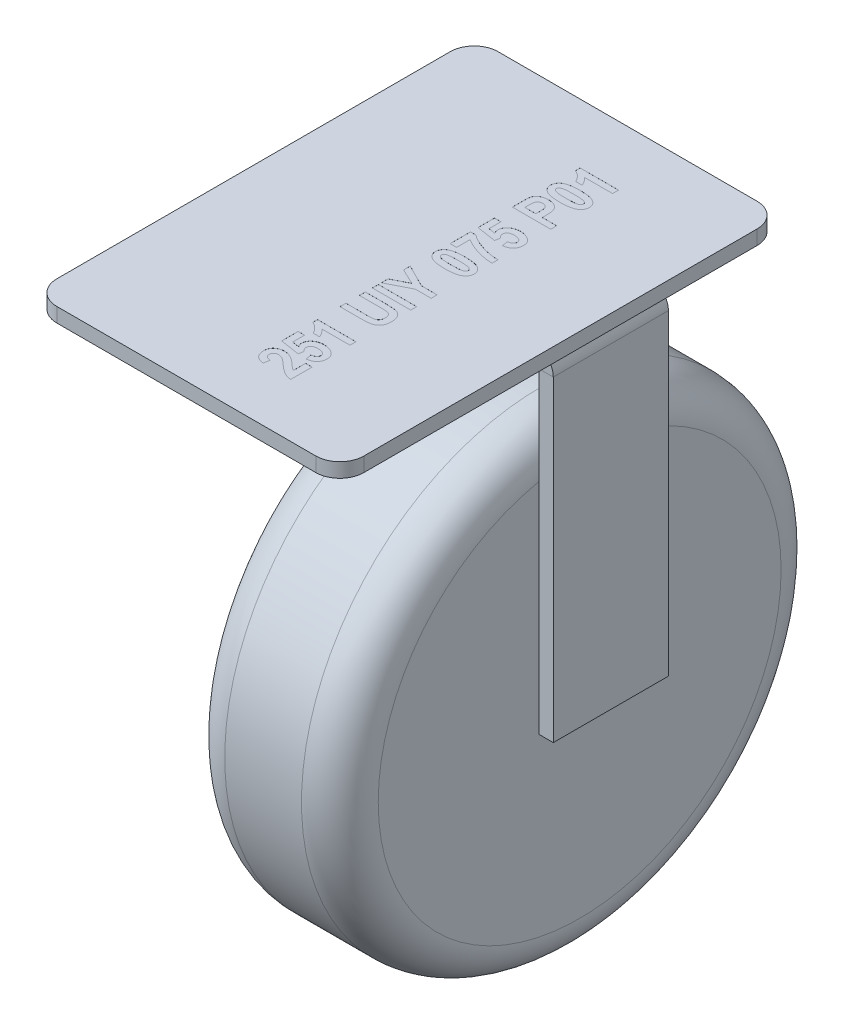
from build123d import *

# Parameters (mm, degrees)
SKETCH1_R                      = 50
BOSS_EXTRUDE1_DEPTH            = 16
FILLET1_R                      = 8
SKETCH2_W                      = 64
SKETCH2_H                      = 92
BASE_FLANGE1_DEPTH             = 3
SKETCH4_W                      = 45
SKETCH4_H                      = 24
BASE_FLANGE2_DEPTH             = 3
EDGE_FLANGE1_STRIP_W           = 14
EDGE_FLANGE1_STRIP_H           = 3
EDGE_FLANGE1_STRIP_CUT_DEPTH   = 24
EDGE_FLANGE1_STRIP_2_W         = 14
EDGE_FLANGE1_STRIP_2_H         = 3
EDGE_FLANGE1_STRIP_CUT_2_DEPTH = 24
EDGE_FLANGE1_DEPTH             = 24
EDGE_FLANGE1_BEND_DEPTH        = 24
SKETCH18_W                     = 8
SKETCH18_H                     = 1.246753247
CUT_EXTRUDE2_DEPTH             = 0.01
FILLET9_R                      = 5
SKETCH21_W                     = 37
SKETCH21_H                     = 25.284571676
BOSS_EXTRUDE2_DEPTH            = 10


# Sheet-metal steps are written as plain solids
with BuildPart() as part:
    # Sketch1 → Boss-Extrude1 (new, symmetric)
    with BuildSketch(Plane(origin=(0, 0, 0), x_dir=(0, 0, -1), z_dir=(1, 0, 0))):
        Circle(SKETCH1_R)
    extrude(amount=BOSS_EXTRUDE1_DEPTH, both=True)

    # Fillet1
    fillet1_edges = [part.edges().sort_by_distance(p)[0] for p in [
        (-16, 0, 50),
        (16, 0, 50),
    ]]
    fillet(fillet1_edges, radius=FILLET1_R)


with BuildPart() as body_2:
    # Sketch2 → Base-Flange1 (new body)
    with BuildSketch(Plane(origin=(0, 80, 0), x_dir=(-1, 0, 0), z_dir=(0, 1, 0))):
        with Locations((0, 34)):
            Rectangle(SKETCH2_W, SKETCH2_H)
    extrude(amount=-BASE_FLANGE1_DEPTH)


with BuildPart() as body_3:
    # Sketch4 → Base-Flange2 (new body)
    with BuildSketch(Plane.XZ.offset(-69)):
        Rectangle(SKETCH4_W, SKETCH4_H)
    extrude(amount=BASE_FLANGE2_DEPTH)

    # Edge-Flange1 strip (across the edge) → Edge-Flange1 strip cut (cut)
    with BuildSketch(Plane(origin=(22.5, 66, -12), x_dir=(-1, 0, 0), z_dir=(0, 0, 1))):
        with Locations((-3, -1.5)):
            Rectangle(EDGE_FLANGE1_STRIP_W, EDGE_FLANGE1_STRIP_H)
    extrude(amount=EDGE_FLANGE1_STRIP_CUT_DEPTH, mode=Mode.SUBTRACT)

    # Edge-Flange1 strip 2 (across the edge) → Edge-Flange1 strip cut 2 (cut)
    with BuildSketch(Plane(origin=(-22.5, 66, 12), x_dir=(1, 0, 0), z_dir=(0, 0, -1))):
        with Locations((-3, -1.5)):
            Rectangle(EDGE_FLANGE1_STRIP_2_W, EDGE_FLANGE1_STRIP_2_H)
    extrude(amount=EDGE_FLANGE1_STRIP_CUT_2_DEPTH, mode=Mode.SUBTRACT)

    # Edge-Flange1 section (across the edge) → Edge-Flange1 (add)
    with BuildSketch(Plane(origin=(22.5, 66, -12), x_dir=(-1, 0, 0), z_dir=(0, 0, 1))):
        with BuildLine():
            Line((0, 1), (0, 67))
            Line((0, 67), (3, 67))
            Line((3, 67), (3, 1))
            ThreePointArc((3, 1), (3.292893219, 0.292893219), (4, 0))
            Line((4, 0), (4, -3))
            ThreePointArc((4, -3), (1.171572875, -1.828427125), (0, 1))
        make_face()
    extrude(amount=EDGE_FLANGE1_DEPTH)

    # Edge-Flange1 section 2 (across the edge) → Edge-Flange1 bend (add)
    with BuildSketch(Plane(origin=(-22.5, 66, 12), x_dir=(1, 0, 0), z_dir=(0, 0, -1))):
        with BuildLine():
            Line((0, 1), (0, 67))
            Line((0, 67), (3, 67))
            Line((3, 67), (3, 1))
            ThreePointArc((3, 1), (3.292893219, 0.292893219), (4, 0))
            Line((4, 0), (4, -3))
            ThreePointArc((4, -3), (1.171572875, -1.828427125), (0, 1))
        make_face()
    extrude(amount=EDGE_FLANGE1_BEND_DEPTH)


with BuildPart() as body_2_1:
    # Body-Move/Copy1: moved
    add(body_2.part.moved(Location((0, 0, -19))))


with BuildPart() as body_2_2:
    # Body-Move/Copy2: moved
    add(body_2_1.part.moved(Location((0, 0, 5))))

    # Sketch18 → Cut-Extrude2 (cut)
    # profile 1 of 12: a face of its own
    with BuildSketch(Plane(origin=(0, 80, 0), x_dir=(1, 0, 0), z_dir=(0, 1, 0))):
        with BuildLine():
            Line((10.5466316, 13.558441558), (10.5466316, 12.311688312))
            Line((10.5466316, 12.311688312), (4.728449782, 12.311688312))
            add(Edge.make_bspline(
                [(4.728449782, 12.311688312), (4.791888738, 12.251212525), (4.917703037, 12.131274882), (5.093552523, 11.940614507), (5.255065198, 11.742518421), (5.406443374, 11.538906194), (5.541416784, 11.326417418), (5.665961261, 11.108046767), (5.776710512, 10.882516949), (5.83975202, 10.727128869), (5.871306925, 10.649350649)],
                knots=[0, 0, 0, 0, 1.033440271, 2.04955398, 3.056225377, 4.046685554, 5.039773713, 6.022867163, 7.010362499, 8, 8, 8, 8], degree=3))
            Line((5.871306925, 10.649350649), (4.520657574, 10.649350649))
            add(Edge.make_bspline(
                [(4.520657574, 10.649350649), (4.480784548, 10.738992213), (4.39777116, 10.925620881), (4.231443365, 11.199293685), (4.020830242, 11.473989473), (3.820882918, 11.703467663), (3.642641396, 11.881877969), (3.502405927, 12.009166943), (3.354306423, 12.122406453), (3.204773431, 12.228978796), (3.047189765, 12.321564678), (2.885651146, 12.403913883), (2.719089986, 12.47687702), (2.60432094, 12.514952196), (2.5466316, 12.534090909)],
                knots=[0, 0, 0, 0, 1.256231514, 2.615402999, 4.090904676, 5.687667505, 6.511353345, 7.321533054, 8.112100619, 8.898827644, 9.67295686, 10.451297706, 11.221535627, 12, 12, 12, 12], degree=3))
            Line((2.5466316, 12.534090909), (2.5466316, 13.558441558))
            Line((2.5466316, 13.558441558), (10.5466316, 13.558441558))
        make_face()
    # profile 2 of 12: a face of its own
    with BuildSketch(Plane(origin=(0, 80, 0), x_dir=(1, 0, 0), z_dir=(0, 1, 0))):
        with BuildLine():
            add(Edge.make_bspline(
                [(2.5466316, 7.373376623), (2.549482926, 7.450951556), (2.555109209, 7.604023699), (2.598363934, 7.827360184), (2.668637157, 8.039975781), (2.768328151, 8.240401546), (2.896728924, 8.428759932), (3.053056284, 8.605524166), (3.237243239, 8.770832782), (3.450942878, 8.925748901), (3.700875335, 9.064961647), (3.991538339, 9.183858726), (4.323935465, 9.283712673), (4.698026414, 9.365079127), (5.114342678, 9.429624685), (5.572922412, 9.473335769), (6.073343699, 9.501165436), (6.421050307, 9.504670953), (6.601826406, 9.506493506)],
                knots=[0, 0, 0, 0, 0.727503026, 1.435521033, 2.125933754, 2.823035237, 3.52857293, 4.258887692, 5.031802202, 5.846339271, 6.730577678, 7.709342118, 8.787052798, 9.983216815, 11.298799232, 12.737663191, 14.303878888, 16, 16, 16, 16], degree=3))
            add(Edge.make_bspline(
                [(6.601826406, 9.506493506), (6.782060627, 9.504666963), (7.128684281, 9.501154184), (7.62749567, 9.473386622), (8.084949085, 9.42943005), (8.500298232, 9.365408839), (8.874118298, 9.283065836), (9.206444741, 9.184619612), (9.496612175, 9.064478959), (9.746325745, 8.925899009), (9.959317051, 8.77069547), (10.144610694, 8.607186899), (10.300423728, 8.430333936), (10.428342042, 8.242335325), (10.528968281, 8.042889462), (10.59822819, 7.831556517), (10.642366094, 7.609508727), (10.647769944, 7.457463674), (10.650527704, 7.37987013)],
                knots=[0, 0, 0, 0, 1.695059366, 3.259911835, 4.697127445, 6.015833273, 7.209868934, 8.295006778, 9.271397414, 10.15773515, 10.974206064, 11.745554658, 12.477603308, 13.184816065, 13.879016739, 14.571068615, 15.270769761, 16, 16, 16, 16], degree=3))
            add(Edge.make_bspline(
                [(10.650527704, 7.37987013), (10.647480668, 7.302335382), (10.641472096, 7.149441551), (10.601069061, 6.925623498), (10.529593331, 6.713768327), (10.432543793, 6.512341557), (10.303475152, 6.325061617), (10.14915665, 6.147695497), (9.966532772, 5.982298689), (9.792991868, 5.856420182), (9.639509083, 5.761799675), (9.511140817, 5.695788029), (9.372110774, 5.634264486), (9.223208126, 5.575041919), (9.061515883, 5.524306517), (8.890112725, 5.475313151), (8.708090997, 5.431649821), (8.51518372, 5.393065488), (8.311906067, 5.356620683), (8.096642769, 5.328797186), (7.871719388, 5.301581201), (7.634954228, 5.283468977), (7.388244176, 5.266530449), (7.130021745, 5.256091135), (6.86163353, 5.24671809), (6.678675555, 5.246741392), (6.585592639, 5.246753247)],
                knots=[0, 0, 0, 0, 1.088282887, 2.146027983, 3.178826917, 4.218279349, 5.273703959, 6.361191414, 7.511779163, 8.724110884, 9.365006532, 10.041034625, 10.748217649, 11.498582071, 12.288826199, 13.125555753, 14.000603745, 14.915204017, 15.88669545, 16.898559194, 17.961282966, 19.066372579, 20.230939374, 21.432180567, 22.693579123, 24, 24, 24, 24], degree=3))
            add(Edge.make_bspline(
                [(6.585592639, 5.246753247), (6.405898538, 5.248574496), (6.060354455, 5.252076681), (5.563176156, 5.279904777), (5.107836086, 5.32359414), (4.694232626, 5.388263425), (4.321858243, 5.469839256), (3.990276407, 5.568965044), (3.70053765, 5.688735595), (3.450835786, 5.827355307), (3.237841712, 5.982549444), (3.052548745, 6.146060308), (2.896735543, 6.322912703), (2.768817272, 6.510911458), (2.668191022, 6.710357284), (2.598931115, 6.921690238), (2.554793211, 7.143738025), (2.549389361, 7.295783079), (2.5466316, 7.373376623)],
                knots=[0, 0, 0, 0, 1.69316225, 3.255878705, 4.690734649, 6.001855936, 7.198146525, 8.280455951, 9.258690493, 10.146702072, 10.964714887, 11.737520167, 12.470951286, 13.179499609, 13.875011277, 14.568370088, 15.269392615, 16, 16, 16, 16], degree=3))
        make_face()
        with BuildLine():
            add(Edge.make_bspline(
                [(3.793384847, 7.376623377), (3.795043429, 7.347792193), (3.798349732, 7.290318652), (3.822057308, 7.206731519), (3.859797197, 7.127219756), (3.914648655, 7.053175472), (3.985942899, 6.98588455), (4.069184924, 6.919588386), (4.169512427, 6.860289794), (4.28795434, 6.802613491), (4.437325144, 6.753474679), (4.623621063, 6.710894137), (4.851654676, 6.676692571), (5.120915703, 6.648418594), (5.431573835, 6.623759096), (5.784605175, 6.608846735), (6.179149557, 6.598965622), (6.456256279, 6.597940904), (6.601826406, 6.597402597)],
                knots=[0, 0, 0, 0, 0.441138569, 0.87938798, 1.320448713, 1.782866373, 2.280957824, 2.818053243, 3.409252662, 4.061580415, 4.832009175, 5.810877931, 6.985235129, 8.360631984, 9.956502567, 11.756597853, 13.7708495, 16, 16, 16, 16], degree=3))
            add(Edge.make_bspline(
                [(6.601826406, 6.597402597), (6.747396683, 6.597934171), (7.023962718, 6.598944097), (7.41796459, 6.608880915), (7.770455601, 6.623751785), (8.081113882, 6.648434888), (8.349842631, 6.67658959), (8.576831617, 6.710785055), (8.761900762, 6.753810564), (8.910474894, 6.802189877), (9.028083177, 6.860602145), (9.128003456, 6.920198814), (9.212749667, 6.984772575), (9.282440307, 7.053803635), (9.337436578, 7.127141382), (9.375082678, 7.206751849), (9.398814427, 7.290313544), (9.402117497, 7.347790487), (9.403774458, 7.376623377)],
                knots=[0, 0, 0, 0, 2.233526578, 4.243432128, 6.047061207, 7.646064667, 9.024161584, 10.192622701, 11.165331889, 11.937273089, 12.583402893, 13.175762905, 13.720469925, 14.213633656, 14.676959095, 15.118885681, 15.557995425, 16, 16, 16, 16], degree=3))
            add(Edge.make_bspline(
                [(9.403774458, 7.376623377), (9.402152147, 7.405996769), (9.398947741, 7.464015426), (9.375171164, 7.548189287), (9.336896935, 7.627851968), (9.283081281, 7.703182967), (9.210957007, 7.770998521), (9.126948598, 7.83660097), (9.025559663, 7.894335546), (8.907634993, 7.952296433), (8.758898704, 8.001588294), (8.573136951, 8.041331409), (8.346846349, 8.07912547), (8.07842236, 8.106522701), (7.76822335, 8.128995821), (7.416350321, 8.144531075), (7.022877647, 8.154240485), (6.746854586, 8.155291783), (6.601826406, 8.155844156)],
                knots=[0, 0, 0, 0, 0.450092843, 0.889028465, 1.330779811, 1.80063996, 2.299511324, 2.844002349, 3.431866051, 4.085215219, 4.856850318, 5.827294631, 6.996618595, 8.374169049, 9.963635982, 11.76654986, 13.775658413, 16, 16, 16, 16], degree=3))
            add(Edge.make_bspline(
                [(6.601826406, 8.155844156), (6.456257366, 8.155287176), (6.179152714, 8.15422691), (5.784594447, 8.14458429), (5.431648462, 8.12890698), (5.120892249, 8.106633193), (4.851413975, 8.078994973), (4.624047937, 8.041259919), (4.437132936, 8.00181261), (4.287877626, 7.952316785), (4.170055346, 7.89423539), (4.068702728, 7.837144636), (3.986084394, 7.770454386), (3.91403074, 7.703243835), (3.860273894, 7.627837133), (3.821985172, 7.548193108), (3.798212326, 7.464014445), (3.795007414, 7.405996439), (3.793384847, 7.376623377)],
                knots=[0, 0, 0, 0, 2.227823008, 4.240875137, 6.039898439, 7.634194999, 9.008772785, 10.183744742, 11.16017094, 11.930140898, 12.582080179, 13.168675308, 13.705450879, 14.203245709, 14.672091929, 15.112890003, 15.55087843, 16, 16, 16, 16], degree=3))
        make_face(mode=Mode.SUBTRACT)
    # profile 3 of 12: a face of its own
    with BuildSketch(Plane(origin=(0, 80, 0), x_dir=(1, 0, 0), z_dir=(0, 1, 0))):
        with BuildLine():
            Line((10.5466316, -0.571428571), (2.5466316, -0.571428571))
            Line((2.5466316, -0.571428571), (2.5466316, 1.584415584))
            add(Edge.make_bspline(
                [(2.5466316, 1.584415584), (2.546969295, 1.680195317), (2.547616114, 1.863651486), (2.551737238, 2.125629129), (2.561826357, 2.362124742), (2.574332126, 2.572150564), (2.590119128, 2.75629119), (2.609659193, 2.913800653), (2.630180219, 3.046174468), (2.652053792, 3.124061528), (2.661891341, 3.159090909)],
                knots=[0, 0, 0, 0, 1.45237712, 2.781878126, 3.972677768, 5.041396282, 5.972228918, 6.774219171, 7.448710173, 8, 8, 8, 8], degree=3))
            add(Edge.make_bspline(
                [(2.661891341, 3.159090909), (2.678922918, 3.207576106), (2.712810313, 3.304046151), (2.778601635, 3.443497272), (2.857841024, 3.576261188), (2.95134511, 3.70196447), (3.057347636, 3.820854248), (3.176421696, 3.933108493), (3.308494167, 4.038720683), (3.453153245, 4.137824703), (3.609473029, 4.228409119), (3.778152084, 4.307414139), (3.958856855, 4.370660986), (4.148627574, 4.426843352), (4.350014345, 4.469089689), (4.562225602, 4.497221936), (4.785486901, 4.515674985), (4.937827356, 4.51819229), (5.015787445, 4.519480519)],
                knots=[0, 0, 0, 0, 0.846069563, 1.683408011, 2.534859899, 3.388780917, 4.260017884, 5.155360507, 6.081068224, 7.042807769, 8.041149003, 9.054027268, 10.105695833, 11.191705716, 12.312280709, 13.490908004, 14.715974479, 16, 16, 16, 16], degree=3))
            add(Edge.make_bspline(
                [(5.015787445, 4.519480519), (5.086711006, 4.518734026), (5.22604769, 4.517267462), (5.430295452, 4.500182928), (5.626109633, 4.474874881), (5.812811832, 4.437865583), (5.990430199, 4.388587386), (6.159275473, 4.330551135), (6.319649313, 4.262255937), (6.470127684, 4.182731603), (6.610650122, 4.094488502), (6.743065026, 4.003470856), (6.860898401, 3.902798678), (6.971346481, 3.801255621), (7.068805285, 3.691327582), (7.156375718, 3.577274655), (7.23167711, 3.456800438), (7.298879318, 3.329547167), (7.354092738, 3.186575712), (7.402672237, 3.024305223), (7.44494228, 2.83953366), (7.475797509, 2.630972902), (7.501766928, 2.399767464), (7.520957898, 2.14583279), (7.532341438, 1.86861261), (7.533198249, 1.676418415), (7.533644587, 1.576298701)],
                knots=[0, 0, 0, 0, 1.135615928, 2.23103514, 3.28022493, 4.296615992, 5.276396387, 6.230189668, 7.154224537, 8.065243604, 8.952666327, 9.81104878, 10.63551073, 11.432550823, 12.212010665, 12.985084557, 13.732872879, 14.484867919, 15.286324822, 16.182841782, 17.196198503, 18.318976939, 19.557414731, 20.922032015, 22.396594263, 24, 24, 24, 24], degree=3))
            Line((7.533644587, 1.576298701), (7.533644587, 0.675324675))
            Line((7.533644587, 0.675324675), (10.5466316, 0.675324675))
            Line((10.5466316, 0.675324675), (10.5466316, -0.571428571))
        make_face()
        with BuildLine():
            Line((3.897280951, 0.675324675), (6.182995237, 0.675324675))
            Line((6.182995237, 0.675324675), (6.182995237, 1.488636364))
            add(Edge.make_bspline(
                [(6.182995237, 1.488636364), (6.182713902, 1.554116253), (6.182174397, 1.679684355), (6.177284688, 1.859915691), (6.169503304, 2.023953887), (6.15801838, 2.171708552), (6.144825308, 2.303065803), (6.124079769, 2.417521419), (6.104620108, 2.516120569), (6.072135484, 2.624366162), (6.019485889, 2.7442631), (5.934410491, 2.87267767), (5.828553431, 2.988787998), (5.701945958, 3.087932127), (5.558983282, 3.172767476), (5.397413827, 3.230028596), (5.221504464, 3.267399213), (5.098786684, 3.270910059), (5.035267964, 3.272727273)],
                knots=[0, 0, 0, 0, 1.284566254, 2.463360063, 3.536877744, 4.505777415, 5.370955964, 6.124908223, 6.787019688, 7.341185285, 8.339304555, 9.34333407, 10.35022176, 11.407981887, 12.487727766, 13.59605896, 14.755720163, 16, 16, 16, 16], degree=3))
            add(Edge.make_bspline(
                [(5.035267964, 3.272727273), (4.970647666, 3.271046967), (4.845638373, 3.26779638), (4.66704255, 3.22854965), (4.502635244, 3.169330896), (4.358074335, 3.082142369), (4.231175205, 2.981105089), (4.126535056, 2.865191252), (4.045318217, 2.737844075), (3.993212072, 2.620468895), (3.96664145, 2.511922375), (3.946912908, 2.410730161), (3.93151708, 2.289230714), (3.91875767, 2.147906405), (3.909189785, 1.987110196), (3.903415486, 1.806304317), (3.897960169, 1.605550607), (3.897514198, 1.464831409), (3.897280951, 1.391233766)],
                knots=[0, 0, 0, 0, 1.216883873, 2.354086848, 3.432980613, 4.499195071, 5.522723566, 6.484091038, 7.429885902, 8.362812208, 8.89019552, 9.534853958, 10.307249648, 11.199115894, 12.211588852, 13.345442179, 14.611637915, 16, 16, 16, 16], degree=3))
            Line((3.897280951, 1.391233766), (3.897280951, 0.675324675))
        make_face(mode=Mode.SUBTRACT)
    # profile 4 of 12: a face of its own
    with BuildSketch(Plane(origin=(0, 80, 0), x_dir=(1, 0, 0), z_dir=(0, 1, 0))):
        with BuildLine():
            Line((8.468709522, -8.571428571), (8.260917315, -7.324675325))
            add(Edge.make_bspline(
                [(8.260917315, -7.324675325), (8.345229148, -7.314040922), (8.50692645, -7.293645752), (8.733303657, -7.22675207), (8.931844531, -7.132183581), (9.099703258, -7.010886646), (9.231455484, -6.870089885), (9.331587734, -6.72226971), (9.391977262, -6.563940175), (9.399861907, -6.455021899), (9.403774458, -6.400974026)],
                knots=[0, 0, 0, 0, 1.267913931, 2.431666527, 3.509083407, 4.539057175, 5.505497605, 6.375431844, 7.193850133, 8, 8, 8, 8], degree=3))
            add(Edge.make_bspline(
                [(9.403774458, -6.400974026), (9.402497597, -6.368947663), (9.399988471, -6.306013457), (9.380825936, -6.213472536), (9.352670851, -6.123829873), (9.308542039, -6.03860062), (9.25562092, -5.955781705), (9.189470188, -5.876865198), (9.110873367, -5.802748367), (9.021827026, -5.730524794), (8.91926563, -5.66610182), (8.804197489, -5.608570678), (8.676321427, -5.560411117), (8.535412704, -5.521922671), (8.382562268, -5.490747846), (8.216966538, -5.470779658), (8.038734457, -5.457348822), (7.915706628, -5.455503571), (7.851826406, -5.454545455)],
                knots=[0, 0, 0, 0, 0.759915694, 1.493291328, 2.23695261, 2.984047812, 3.764651827, 4.567572245, 5.421908294, 6.327020061, 7.285992678, 8.291697758, 9.377615963, 10.524980024, 11.757348812, 13.078695297, 14.4831595, 16, 16, 16, 16], degree=3))
            add(Edge.make_bspline(
                [(7.851826406, -5.454545455), (7.791736625, -5.455539613), (7.675200798, -5.457467646), (7.506646694, -5.470556595), (7.349802025, -5.491096295), (7.205112718, -5.521165676), (7.073295406, -5.562845708), (6.952184057, -5.608557394), (6.843623431, -5.665823588), (6.748745761, -5.733082007), (6.662738189, -5.803669694), (6.59198271, -5.883049699), (6.529012759, -5.964013606), (6.47797516, -6.051174794), (6.439247245, -6.143609352), (6.411941538, -6.240715509), (6.392557848, -6.341763561), (6.391383999, -6.411160659), (6.390787445, -6.446428571)],
                knots=[0, 0, 0, 0, 1.452992624, 2.817878434, 4.08552741, 5.276356634, 6.385596521, 7.425606029, 8.403153558, 9.343289966, 10.234624763, 11.086674211, 11.90844429, 12.711882619, 13.521160352, 14.324598681, 15.14855363, 16, 16, 16, 16], degree=3))
            add(Edge.make_bspline(
                [(6.390787445, -6.446428571), (6.39232589, -6.491453486), (6.395388474, -6.581084593), (6.420806679, -6.713594978), (6.461565908, -6.842766521), (6.519032664, -6.968550269), (6.592836924, -7.090827101), (6.682379219, -7.209599903), (6.789316517, -7.323990716), (6.869090613, -7.395108829), (6.910267964, -7.431818182)],
                knots=[0, 0, 0, 0, 0.937869113, 1.867016208, 2.801624103, 3.755632097, 4.742157478, 5.773077042, 6.850519244, 8, 8, 8, 8], degree=3))
            Line((6.910267964, -7.431818182), (6.702475756, -8.467532468))
            Line((6.702475756, -8.467532468), (2.650527704, -7.844155844))
            Line((2.650527704, -7.844155844), (2.650527704, -4.415584416))
            Line((2.650527704, -4.415584416), (4.001177055, -4.415584416))
            Line((4.001177055, -4.415584416), (4.001177055, -6.897727273))
            Line((4.001177055, -6.897727273), (5.44598225, -7.12012987))
            add(Edge.make_bspline(
                [(5.44598225, -7.12012987), (5.399910422, -7.046090264), (5.310441535, -6.902309533), (5.21670486, -6.672651015), (5.15574657, -6.442546599), (5.14791275, -6.287702719), (5.144034198, -6.211038961)],
                knots=[0, 0, 0, 0, 1.075688055, 2.088925425, 3.053820156, 4, 4, 4, 4], degree=3))
            add(Edge.make_bspline(
                [(5.144034198, -6.211038961), (5.14575723, -6.143812436), (5.14913695, -6.01194788), (5.180232517, -5.818557676), (5.226197752, -5.631856349), (5.295121798, -5.453732191), (5.381917146, -5.282729812), (5.488261106, -5.120710019), (5.61162003, -4.964085798), (5.70834868, -4.870679675), (5.757670561, -4.823051948)],
                knots=[0, 0, 0, 0, 1.031196759, 2.022688252, 2.999774745, 3.977814063, 4.947386575, 5.938077482, 6.948626928, 8, 8, 8, 8], degree=3))
            add(Edge.make_bspline(
                [(5.757670561, -4.823051948), (5.824095534, -4.765218141), (5.956799612, -4.649677527), (6.178271696, -4.503944295), (6.414315967, -4.379959898), (6.6660267, -4.279803697), (6.932236108, -4.198520851), (7.215434494, -4.145629761), (7.513251544, -4.109872291), (7.71697501, -4.105915944), (7.82098225, -4.103896104)],
                knots=[0, 0, 0, 0, 0.94374017, 1.88540791, 2.835550974, 3.799054059, 4.786896658, 5.815859071, 6.884927323, 8, 8, 8, 8], degree=3))
            add(Edge.make_bspline(
                [(7.82098225, -4.103896104), (7.908177321, -4.105856319), (8.081376894, -4.109749985), (8.337987157, -4.138224689), (8.589920248, -4.183385964), (8.836168716, -4.248578222), (9.077124241, -4.331474701), (9.312633407, -4.432948789), (9.542553941, -4.553104787), (9.764783559, -4.689531143), (9.973172394, -4.840891019), (10.153951719, -5.014213653), (10.307977839, -5.202050511), (10.435636216, -5.405248054), (10.53026071, -5.626644865), (10.60151057, -5.862094851), (10.641740635, -6.114432486), (10.647548924, -6.287741733), (10.650527704, -6.376623377)],
                knots=[0, 0, 0, 0, 1.03338934, 2.052668673, 3.056636443, 4.064775332, 5.068845542, 6.074451108, 7.101510927, 8.141092324, 9.1635151, 10.147972028, 11.100657026, 12.036876128, 12.981864856, 13.945797696, 14.94650239, 16, 16, 16, 16], degree=3))
            add(Edge.make_bspline(
                [(10.650527704, -6.376623377), (10.649333191, -6.448698804), (10.646979795, -6.590699763), (10.617449056, -6.799073337), (10.574955127, -6.998849055), (10.512838407, -7.18953641), (10.430535866, -7.369769545), (10.333513874, -7.542869235), (10.217366424, -7.705899401), (10.083933122, -7.858441871), (9.934899094, -7.99981943), (9.769886169, -8.126681169), (9.59061019, -8.240020482), (9.394165756, -8.33450651), (9.184817896, -8.418576031), (8.959228704, -8.483429368), (8.720033378, -8.538977241), (8.553919236, -8.56042616), (8.468709522, -8.571428571)],
                knots=[0, 0, 0, 0, 1.008787239, 1.987483963, 2.941960961, 3.86715834, 4.789899755, 5.713107995, 6.642672678, 7.588138984, 8.547868068, 9.515110056, 10.499309066, 11.512840357, 12.564236465, 13.655396696, 14.797315056, 16, 16, 16, 16], degree=3))
        make_face()
    # profile 5 of 12: a face of its own
    with BuildSketch(Plane(origin=(0, 80, 0), x_dir=(1, 0, 0), z_dir=(0, 1, 0))):
        with BuildLine():
            Line((4.001177055, -13.662337662), (2.650527704, -13.662337662))
            Line((2.650527704, -13.662337662), (2.650527704, -9.402597403))
            Line((2.650527704, -9.402597403), (3.764164068, -9.402597403))
            add(Edge.make_bspline(
                [(3.764164068, -9.402597403), (3.819939534, -9.447104032), (3.93464167, -9.538631827), (4.122097798, -9.667081986), (4.322026468, -9.801736573), (4.54254003, -9.931518428), (4.776860173, -10.065656847), (5.030542606, -10.196114761), (5.298401447, -10.331548923), (5.681693959, -10.508905171), (6.179971739, -10.72139282), (6.80134863, -10.943437767), (7.443749934, -11.134716402), (8.098362783, -11.294973359), (8.748145431, -11.421534122), (9.374693268, -11.514925049), (9.970827285, -11.573637638), (10.35819701, -11.580888452), (10.5466316, -11.584415584)],
                knots=[0, 0, 0, 0, 0.473354227, 0.97345203, 1.507272221, 2.072602285, 2.670769392, 3.298770199, 3.965211577, 4.662431092, 6.101005462, 7.5582634, 9.038592123, 10.547028228, 12.028736911, 13.429840929, 14.749755492, 16, 16, 16, 16], degree=3))
            Line((10.5466316, -11.584415584), (10.5466316, -12.831168831))
            add(Edge.make_bspline(
                [(10.5466316, -12.831168831), (10.403171738, -12.826369559), (10.115386881, -12.816742072), (9.684466334, -12.781390109), (9.253480624, -12.732930593), (8.823082356, -12.669329723), (8.392448319, -12.591824712), (7.962689799, -12.497363413), (7.533013838, -12.387871638), (7.104787618, -12.26609521), (6.682784184, -12.127134674), (6.267758352, -11.980646511), (5.864544261, -11.819154133), (5.470228016, -11.649160367), (5.087508955, -11.465804909), (4.715792015, -11.270011715), (4.352108029, -11.066707984), (4.117986795, -10.919316848), (4.001177055, -10.845779221)],
                knots=[0, 0, 0, 0, 0.99531935, 1.996640963, 2.997456141, 4.002630936, 5.013275835, 6.031279154, 7.053396583, 8.087948754, 9.118033235, 10.134077209, 11.139644213, 12.129593714, 13.111515847, 14.081722421, 15.042916779, 16, 16, 16, 16], degree=3))
            Line((4.001177055, -10.845779221), (4.001177055, -13.662337662))
        make_face()
    # profile 6 of 12: a face of its own
    with BuildSketch(Plane(origin=(0, 80, 0), x_dir=(1, 0, 0), z_dir=(0, 1, 0))):
        with BuildLine():
            add(Edge.make_bspline(
                [(2.5466316, -16.626623377), (2.549482926, -16.549048444), (2.555109209, -16.395976301), (2.598363934, -16.172639816), (2.668637157, -15.960024219), (2.768328151, -15.759598454), (2.896728924, -15.571240068), (3.053056284, -15.394475834), (3.237243239, -15.229167218), (3.450942878, -15.074251099), (3.700875335, -14.935038353), (3.991538339, -14.816141274), (4.323935465, -14.716287327), (4.698026414, -14.634920873), (5.114342678, -14.570375315), (5.572922412, -14.526664231), (6.073343699, -14.498834564), (6.421050307, -14.495329047), (6.601826406, -14.493506494)],
                knots=[0, 0, 0, 0, 0.727503026, 1.435521033, 2.125933754, 2.823035237, 3.52857293, 4.258887692, 5.031802202, 5.846339271, 6.730577678, 7.709342118, 8.787052798, 9.983216815, 11.298799232, 12.737663191, 14.303878888, 16, 16, 16, 16], degree=3))
            add(Edge.make_bspline(
                [(6.601826406, -14.493506494), (6.782060627, -14.495333037), (7.128684281, -14.498845816), (7.62749567, -14.526613378), (8.084949085, -14.57056995), (8.500298232, -14.634591161), (8.874118298, -14.716934164), (9.206444741, -14.815380388), (9.496612175, -14.935521041), (9.746325745, -15.074100991), (9.959317051, -15.22930453), (10.144610694, -15.392813101), (10.300423728, -15.569666064), (10.428342042, -15.757664675), (10.528968281, -15.957110538), (10.59822819, -16.168443483), (10.642366094, -16.390491273), (10.647769944, -16.542536326), (10.650527704, -16.62012987)],
                knots=[0, 0, 0, 0, 1.695059366, 3.259911835, 4.697127445, 6.015833273, 7.209868934, 8.295006778, 9.271397414, 10.15773515, 10.974206064, 11.745554658, 12.477603308, 13.184816065, 13.879016739, 14.571068615, 15.270769761, 16, 16, 16, 16], degree=3))
            add(Edge.make_bspline(
                [(10.650527704, -16.62012987), (10.647480668, -16.697664618), (10.641472096, -16.850558449), (10.601069061, -17.074376502), (10.529593331, -17.286231673), (10.432543793, -17.487658443), (10.303475152, -17.674938383), (10.14915665, -17.852304503), (9.966532772, -18.017701311), (9.792991868, -18.143579818), (9.639509083, -18.238200325), (9.511140817, -18.304211971), (9.372110774, -18.365735514), (9.223208126, -18.424958081), (9.061515883, -18.475693483), (8.890112725, -18.524686849), (8.708090997, -18.568350179), (8.51518372, -18.606934512), (8.311906067, -18.643379317), (8.096642769, -18.671202814), (7.871719388, -18.698418799), (7.634954228, -18.716531023), (7.388244176, -18.733469551), (7.130021745, -18.743908865), (6.86163353, -18.75328191), (6.678675555, -18.753258608), (6.585592639, -18.753246753)],
                knots=[0, 0, 0, 0, 1.088282887, 2.146027983, 3.178826917, 4.218279349, 5.273703959, 6.361191414, 7.511779163, 8.724110884, 9.365006532, 10.041034625, 10.748217649, 11.498582071, 12.288826199, 13.125555753, 14.000603745, 14.915204017, 15.88669545, 16.898559194, 17.961282966, 19.066372579, 20.230939374, 21.432180567, 22.693579123, 24, 24, 24, 24], degree=3))
            add(Edge.make_bspline(
                [(6.585592639, -18.753246753), (6.405898538, -18.751425504), (6.060354455, -18.747923319), (5.563176156, -18.720095223), (5.107836086, -18.67640586), (4.694232626, -18.611736575), (4.321858243, -18.530160744), (3.990276407, -18.431034956), (3.70053765, -18.311264405), (3.450835786, -18.172644693), (3.237841712, -18.017450556), (3.052548745, -17.853939692), (2.896735543, -17.677087297), (2.768817272, -17.489088542), (2.668191022, -17.289642716), (2.598931115, -17.078309762), (2.554793211, -16.856261975), (2.549389361, -16.704216921), (2.5466316, -16.626623377)],
                knots=[0, 0, 0, 0, 1.69316225, 3.255878705, 4.690734649, 6.001855936, 7.198146525, 8.280455951, 9.258690493, 10.146702072, 10.964714887, 11.737520167, 12.470951286, 13.179499609, 13.875011277, 14.568370088, 15.269392615, 16, 16, 16, 16], degree=3))
        make_face()
        with BuildLine():
            add(Edge.make_bspline(
                [(3.793384847, -16.623376623), (3.795043429, -16.652207807), (3.798349732, -16.709681348), (3.822057308, -16.793268481), (3.859797197, -16.872780244), (3.914648655, -16.946824528), (3.985942899, -17.01411545), (4.069184924, -17.080411614), (4.169512427, -17.139710206), (4.28795434, -17.197386509), (4.437325144, -17.246525321), (4.623621063, -17.289105863), (4.851654676, -17.323307429), (5.120915703, -17.351581406), (5.431573835, -17.376240904), (5.784605175, -17.391153265), (6.179149557, -17.401034378), (6.456256279, -17.402059096), (6.601826406, -17.402597403)],
                knots=[0, 0, 0, 0, 0.441138569, 0.87938798, 1.320448713, 1.782866373, 2.280957824, 2.818053243, 3.409252662, 4.061580415, 4.832009175, 5.810877931, 6.985235129, 8.360631984, 9.956502567, 11.756597853, 13.7708495, 16, 16, 16, 16], degree=3))
            add(Edge.make_bspline(
                [(6.601826406, -17.402597403), (6.747396683, -17.402065829), (7.023962718, -17.401055903), (7.41796459, -17.391119085), (7.770455601, -17.376248215), (8.081113882, -17.351565112), (8.349842631, -17.32341041), (8.576831617, -17.289214945), (8.761900762, -17.246189436), (8.910474894, -17.197810123), (9.028083177, -17.139397855), (9.128003456, -17.079801186), (9.212749667, -17.015227425), (9.282440307, -16.946196365), (9.337436578, -16.872858618), (9.375082678, -16.793248151), (9.398814427, -16.709686456), (9.402117497, -16.652209513), (9.403774458, -16.623376623)],
                knots=[0, 0, 0, 0, 2.233526578, 4.243432128, 6.047061207, 7.646064667, 9.024161584, 10.192622701, 11.165331889, 11.937273089, 12.583402893, 13.175762905, 13.720469925, 14.213633656, 14.676959095, 15.118885681, 15.557995425, 16, 16, 16, 16], degree=3))
            add(Edge.make_bspline(
                [(9.403774458, -16.623376623), (9.402152147, -16.594003231), (9.398947741, -16.535984574), (9.375171164, -16.451810713), (9.336896935, -16.372148032), (9.283081281, -16.296817033), (9.210957007, -16.229001479), (9.126948598, -16.16339903), (9.025559663, -16.105664454), (8.907634993, -16.047703567), (8.758898704, -15.998411706), (8.573136951, -15.958668591), (8.346846349, -15.92087453), (8.07842236, -15.893477299), (7.76822335, -15.871004179), (7.416350321, -15.855468925), (7.022877647, -15.845759515), (6.746854586, -15.844708217), (6.601826406, -15.844155844)],
                knots=[0, 0, 0, 0, 0.450092843, 0.889028465, 1.330779811, 1.80063996, 2.299511324, 2.844002349, 3.431866051, 4.085215219, 4.856850318, 5.827294631, 6.996618595, 8.374169049, 9.963635982, 11.76654986, 13.775658413, 16, 16, 16, 16], degree=3))
            add(Edge.make_bspline(
                [(6.601826406, -15.844155844), (6.456257366, -15.844712824), (6.179152714, -15.84577309), (5.784594447, -15.85541571), (5.431648462, -15.87109302), (5.120892249, -15.893366807), (4.851413975, -15.921005027), (4.624047937, -15.958740081), (4.437132936, -15.99818739), (4.287877626, -16.047683215), (4.170055346, -16.10576461), (4.068702728, -16.162855364), (3.986084394, -16.229545614), (3.91403074, -16.296756165), (3.860273894, -16.372162867), (3.821985172, -16.451806892), (3.798212326, -16.535985555), (3.795007414, -16.594003561), (3.793384847, -16.623376623)],
                knots=[0, 0, 0, 0, 2.227823008, 4.240875137, 6.039898439, 7.634194999, 9.008772785, 10.183744742, 11.16017094, 11.930140898, 12.582080179, 13.168675308, 13.705450879, 14.203245709, 14.672091929, 15.112890003, 15.55087843, 16, 16, 16, 16], degree=3))
        make_face(mode=Mode.SUBTRACT)
    # profile 7 of 12: a face of its own
    with BuildSketch(Plane(origin=(0, 80, 0), x_dir=(1, 0, 0), z_dir=(0, 1, 0))):
        Polygon((10.5466316, -25.506493506), (7.251177055, -25.506493506), (2.5466316, -27.896103896), (2.5466316, -26.508116883), (5.814488743, -24.821428571), (2.5466316, -23.256493506), (2.5466316, -21.87012987), (7.262540691, -24.25974026), (10.5466316, -24.25974026), align=None)
    # profile 8 of 12: a face of its own
    with BuildSketch(Plane(origin=(0, 80, 0), x_dir=(1, 0, 0), z_dir=(0, 1, 0))):
        with Locations((6.5466316, -29.142857143)):
            Rectangle(SKETCH18_W, SKETCH18_H)
    # profile 9 of 12: a face of its own
    with BuildSketch(Plane(origin=(0, 80, 0), x_dir=(1, 0, 0), z_dir=(0, 1, 0))):
        with BuildLine():
            Line((2.5466316, -36.519480519), (2.5466316, -35.272727273))
            Line((2.5466316, -35.272727273), (6.877800432, -35.272727273))
            add(Edge.make_bspline(
                [(6.877800432, -35.272727273), (6.958426273, -35.272085368), (7.112102734, -35.27086187), (7.331301486, -35.270683444), (7.528769302, -35.264384719), (7.704182826, -35.260994), (7.857894307, -35.252684583), (7.988744516, -35.242311647), (8.098437055, -35.234397453), (8.163561315, -35.223871314), (8.192735496, -35.219155844)],
                knots=[0, 0, 0, 0, 1.469283925, 2.800520868, 3.994037541, 5.069265641, 5.997485907, 6.798394439, 7.461708143, 8, 8, 8, 8], degree=3))
            add(Edge.make_bspline(
                [(8.192735496, -35.219155844), (8.277011097, -35.201104605), (8.439658551, -35.166266669), (8.661821096, -35.065570184), (8.856553515, -34.937012421), (9.017424723, -34.771430577), (9.145912892, -34.575534432), (9.236829407, -34.349448453), (9.290850156, -34.095062723), (9.296779934, -33.916404289), (9.299878354, -33.823051948)],
                knots=[0, 0, 0, 0, 1.052134743, 2.030564437, 2.965552675, 3.892862465, 4.835210629, 5.81543191, 6.858522707, 8, 8, 8, 8], degree=3))
            add(Edge.make_bspline(
                [(9.299878354, -33.823051948), (9.29738982, -33.74391943), (9.2926209, -33.592273281), (9.2565229, -33.375744987), (9.190422835, -33.182894323), (9.101571441, -33.01224101), (8.988081139, -32.866253867), (8.854653913, -32.74357094), (8.700024411, -32.646890218), (8.552831826, -32.587963), (8.415732812, -32.551544639), (8.285689947, -32.530508615), (8.130309127, -32.510919445), (7.948867958, -32.495311805), (7.741012218, -32.482648997), (7.507216764, -32.47267987), (7.247404937, -32.468495992), (7.065571662, -32.467863663), (6.970332899, -32.467532468)],
                knots=[0, 0, 0, 0, 1.210143802, 2.319067452, 3.342413863, 4.316095243, 5.248119048, 6.156132454, 7.074646075, 8.021362679, 8.569409836, 9.241571058, 10.034061653, 10.964688065, 12.026113961, 13.218926752, 14.543358066, 16, 16, 16, 16], degree=3))
            Line((6.970332899, -32.467532468), (2.5466316, -32.467532468))
            Line((2.5466316, -32.467532468), (2.5466316, -31.220779221))
            Line((2.5466316, -31.220779221), (6.731696535, -31.220779221))
            add(Edge.make_bspline(
                [(6.731696535, -31.220779221), (6.860489589, -31.221468791), (7.109443565, -31.222801713), (7.468788785, -31.231081027), (7.800626213, -31.243177697), (8.104256032, -31.262824901), (8.380314325, -31.286992824), (8.628570394, -31.314867357), (8.848805276, -31.351256935), (9.045157929, -31.390519476), (9.223607277, -31.442516149), (9.391070918, -31.504834221), (9.548886878, -31.583397879), (9.698232411, -31.675311556), (9.839118921, -31.780520358), (9.971751613, -31.900042227), (10.094786922, -32.033803643), (10.210413265, -32.179567489), (10.314380555, -32.338382411), (10.404044427, -32.510419308), (10.479932412, -32.69422326), (10.543852106, -32.889916031), (10.592146977, -33.098014026), (10.62548578, -33.318405158), (10.647467203, -33.550419523), (10.649492676, -33.709363235), (10.650527704, -33.790584416)],
                knots=[0, 0, 0, 0, 1.69941726, 3.284934, 4.742645532, 6.080601134, 7.299143691, 8.399121829, 9.375758488, 10.243985084, 11.039399806, 11.825790082, 12.59854505, 13.361473367, 14.136895684, 14.91546747, 15.713761241, 16.532267381, 17.368001279, 18.214343285, 19.088188771, 19.989122623, 20.927829205, 21.903342887, 22.928595776, 24, 24, 24, 24], degree=3))
            add(Edge.make_bspline(
                [(10.650527704, -33.790584416), (10.649030977, -33.875016263), (10.646130646, -34.038626772), (10.630910996, -34.2772674), (10.600568442, -34.501345807), (10.563619424, -34.712346246), (10.510694831, -34.908486541), (10.448001045, -35.090565321), (10.373544952, -35.258736155), (10.28629099, -35.412196247), (10.190663372, -35.554285786), (10.083641894, -35.684714517), (9.969252479, -35.807000004), (9.8432557, -35.917114847), (9.709601149, -36.018519231), (9.56666797, -36.109997292), (9.412569633, -36.188791129), (9.247303346, -36.2629184), (9.058476726, -36.326076495), (8.837913538, -36.375799194), (8.583359326, -36.42103676), (8.293556871, -36.458228093), (7.968986761, -36.483931266), (7.609668612, -36.506040939), (7.21497489, -36.515960325), (6.940032312, -36.518273859), (6.7966316, -36.519480519)],
                knots=[0, 0, 0, 0, 1.101224802, 2.133933526, 3.116022997, 4.048911379, 4.925321078, 5.76223065, 6.558275546, 7.319790459, 8.061595544, 8.788995274, 9.517797108, 10.242728047, 10.968174012, 11.704250786, 12.452306349, 13.223277401, 14.064578671, 15.043646438, 16.169047867, 17.435603448, 18.852055607, 20.41430735, 22.129824478, 24, 24, 24, 24], degree=3))
            Line((6.7966316, -36.519480519), (2.5466316, -36.519480519))
        make_face()
    # profile 10 of 12: a face of its own
    with BuildSketch(Plane(origin=(0, 80, 0), x_dir=(1, 0, 0), z_dir=(0, 1, 0))):
        with BuildLine():
            Line((10.5466316, -41.194805195), (10.5466316, -42.441558442))
            Line((10.5466316, -42.441558442), (4.728449782, -42.441558442))
            add(Edge.make_bspline(
                [(4.728449782, -42.441558442), (4.791888738, -42.502034229), (4.917703037, -42.621971871), (5.093552523, -42.812632246), (5.255065198, -43.010728332), (5.406443374, -43.214340559), (5.541416784, -43.426829335), (5.665961261, -43.645199986), (5.776710512, -43.870729804), (5.83975202, -44.026117885), (5.871306925, -44.103896104)],
                knots=[0, 0, 0, 0, 1.033440271, 2.04955398, 3.056225377, 4.046685554, 5.039773713, 6.022867163, 7.010362499, 8, 8, 8, 8], degree=3))
            Line((5.871306925, -44.103896104), (4.520657574, -44.103896104))
            add(Edge.make_bspline(
                [(4.520657574, -44.103896104), (4.480784548, -44.01425454), (4.39777116, -43.827625872), (4.231443365, -43.553953068), (4.020830242, -43.279257281), (3.820882918, -43.049779091), (3.642641396, -42.871368784), (3.502405927, -42.74407981), (3.354306423, -42.6308403), (3.204773431, -42.524267957), (3.047189765, -42.431682075), (2.885651146, -42.349332871), (2.719089986, -42.276369733), (2.60432094, -42.238294557), (2.5466316, -42.219155844)],
                knots=[0, 0, 0, 0, 1.256231514, 2.615402999, 4.090904676, 5.687667505, 6.511353345, 7.321533054, 8.112100619, 8.898827644, 9.67295686, 10.451297706, 11.221535627, 12, 12, 12, 12], degree=3))
            Line((2.5466316, -42.219155844), (2.5466316, -41.194805195))
            Line((2.5466316, -41.194805195), (10.5466316, -41.194805195))
        make_face()
    # profile 11 of 12: a face of its own
    with BuildSketch(Plane(origin=(0, 80, 0), x_dir=(1, 0, 0), z_dir=(0, 1, 0))):
        with BuildLine():
            Line((8.468709522, -49.506493506), (8.260917315, -48.25974026))
            add(Edge.make_bspline(
                [(8.260917315, -48.25974026), (8.345229148, -48.249105857), (8.50692645, -48.228710687), (8.733303657, -48.161817005), (8.931844531, -48.067248516), (9.099703258, -47.945951581), (9.231455484, -47.80515482), (9.331587734, -47.657334645), (9.391977262, -47.49900511), (9.399861907, -47.390086834), (9.403774458, -47.336038961)],
                knots=[0, 0, 0, 0, 1.267913931, 2.431666527, 3.509083407, 4.539057175, 5.505497605, 6.375431844, 7.193850133, 8, 8, 8, 8], degree=3))
            add(Edge.make_bspline(
                [(9.403774458, -47.336038961), (9.402497597, -47.304012598), (9.399988471, -47.241078392), (9.380825936, -47.148537471), (9.352670851, -47.058894808), (9.308542039, -46.973665556), (9.25562092, -46.89084664), (9.189470188, -46.811930133), (9.110873367, -46.737813302), (9.021827026, -46.665589729), (8.91926563, -46.601166756), (8.804197489, -46.543635613), (8.676321427, -46.495476052), (8.535412704, -46.456987606), (8.382562268, -46.425812781), (8.216966538, -46.405844593), (8.038734457, -46.392413757), (7.915706628, -46.390568506), (7.851826406, -46.38961039)],
                knots=[0, 0, 0, 0, 0.759915694, 1.493291328, 2.23695261, 2.984047812, 3.764651827, 4.567572245, 5.421908294, 6.327020061, 7.285992678, 8.291697758, 9.377615963, 10.524980024, 11.757348812, 13.078695297, 14.4831595, 16, 16, 16, 16], degree=3))
            add(Edge.make_bspline(
                [(7.851826406, -46.38961039), (7.791736625, -46.390604548), (7.675200798, -46.392532581), (7.506646694, -46.40562153), (7.349802025, -46.42616123), (7.205112718, -46.456230611), (7.073295406, -46.497910644), (6.952184057, -46.543622329), (6.843623431, -46.600888523), (6.748745761, -46.668146942), (6.662738189, -46.738734629), (6.59198271, -46.818114634), (6.529012759, -46.899078541), (6.47797516, -46.986239729), (6.439247245, -47.078674287), (6.411941538, -47.175780444), (6.392557848, -47.276828496), (6.391383999, -47.346225594), (6.390787445, -47.381493506)],
                knots=[0, 0, 0, 0, 1.452992624, 2.817878434, 4.08552741, 5.276356634, 6.385596521, 7.425606029, 8.403153558, 9.343289966, 10.234624763, 11.086674211, 11.90844429, 12.711882619, 13.521160352, 14.324598681, 15.14855363, 16, 16, 16, 16], degree=3))
            add(Edge.make_bspline(
                [(6.390787445, -47.381493506), (6.39232589, -47.426518422), (6.395388474, -47.516149528), (6.420806679, -47.648659913), (6.461565908, -47.777831456), (6.519032664, -47.903615204), (6.592836924, -48.025892036), (6.682379219, -48.144664838), (6.789316517, -48.259055651), (6.869090613, -48.330173764), (6.910267964, -48.366883117)],
                knots=[0, 0, 0, 0, 0.937869113, 1.867016208, 2.801624103, 3.755632097, 4.742157478, 5.773077042, 6.850519244, 8, 8, 8, 8], degree=3))
            Line((6.910267964, -48.366883117), (6.702475756, -49.402597403))
            Line((6.702475756, -49.402597403), (2.650527704, -48.779220779))
            Line((2.650527704, -48.779220779), (2.650527704, -45.350649351))
            Line((2.650527704, -45.350649351), (4.001177055, -45.350649351))
            Line((4.001177055, -45.350649351), (4.001177055, -47.832792208))
            Line((4.001177055, -47.832792208), (5.44598225, -48.055194805))
            add(Edge.make_bspline(
                [(5.44598225, -48.055194805), (5.399910422, -47.981155199), (5.310441535, -47.837374468), (5.21670486, -47.60771595), (5.15574657, -47.377611535), (5.14791275, -47.222767654), (5.144034198, -47.146103896)],
                knots=[0, 0, 0, 0, 1.075688055, 2.088925425, 3.053820156, 4, 4, 4, 4], degree=3))
            add(Edge.make_bspline(
                [(5.144034198, -47.146103896), (5.14575723, -47.078877371), (5.14913695, -46.947012815), (5.180232517, -46.753622611), (5.226197752, -46.566921284), (5.295121798, -46.388797127), (5.381917146, -46.217794747), (5.488261106, -46.055774954), (5.61162003, -45.899150733), (5.70834868, -45.80574461), (5.757670561, -45.758116883)],
                knots=[0, 0, 0, 0, 1.031196759, 2.022688252, 2.999774745, 3.977814063, 4.947386575, 5.938077482, 6.948626928, 8, 8, 8, 8], degree=3))
            add(Edge.make_bspline(
                [(5.757670561, -45.758116883), (5.824095534, -45.700283076), (5.956799612, -45.584742462), (6.178271696, -45.439009231), (6.414315967, -45.315024833), (6.6660267, -45.214868632), (6.932236108, -45.133585786), (7.215434494, -45.080694696), (7.513251544, -45.044937226), (7.71697501, -45.040980879), (7.82098225, -45.038961039)],
                knots=[0, 0, 0, 0, 0.94374017, 1.88540791, 2.835550974, 3.799054059, 4.786896658, 5.815859071, 6.884927323, 8, 8, 8, 8], degree=3))
            add(Edge.make_bspline(
                [(7.82098225, -45.038961039), (7.908177321, -45.040921254), (8.081376894, -45.04481492), (8.337987157, -45.073289624), (8.589920248, -45.118450899), (8.836168716, -45.183643157), (9.077124241, -45.266539636), (9.312633407, -45.368013724), (9.542553941, -45.488169722), (9.764783559, -45.624596078), (9.973172394, -45.775955954), (10.153951719, -45.949278588), (10.307977839, -46.137115446), (10.435636216, -46.34031299), (10.53026071, -46.5617098), (10.60151057, -46.797159786), (10.641740635, -47.049497421), (10.647548924, -47.222806668), (10.650527704, -47.311688312)],
                knots=[0, 0, 0, 0, 1.03338934, 2.052668673, 3.056636443, 4.064775332, 5.068845542, 6.074451108, 7.101510927, 8.141092324, 9.1635151, 10.147972028, 11.100657026, 12.036876128, 12.981864856, 13.945797696, 14.94650239, 16, 16, 16, 16], degree=3))
            add(Edge.make_bspline(
                [(10.650527704, -47.311688312), (10.649333191, -47.383763739), (10.646979795, -47.525764698), (10.617449056, -47.734138272), (10.574955127, -47.93391399), (10.512838407, -48.124601345), (10.430535866, -48.30483448), (10.333513874, -48.47793417), (10.217366424, -48.640964336), (10.083933122, -48.793506806), (9.934899094, -48.934884365), (9.769886169, -49.061746104), (9.59061019, -49.175085417), (9.394165756, -49.269571445), (9.184817896, -49.353640966), (8.959228704, -49.418494303), (8.720033378, -49.474042176), (8.553919236, -49.495491095), (8.468709522, -49.506493506)],
                knots=[0, 0, 0, 0, 1.008787239, 1.987483963, 2.941960961, 3.86715834, 4.789899755, 5.713107995, 6.642672678, 7.588138984, 8.547868068, 9.515110056, 10.499309066, 11.512840357, 12.564236465, 13.655396696, 14.797315056, 16, 16, 16, 16], degree=3))
        make_face()
    # profile 12 of 12: a face of its own
    with BuildSketch(Plane(origin=(0, 80, 0), x_dir=(1, 0, 0), z_dir=(0, 1, 0))):
        with BuildLine():
            Line((9.19598225, -50.337662338), (10.5466316, -50.337662338))
            Line((10.5466316, -50.337662338), (10.5466316, -54.805194805))
            add(Edge.make_bspline(
                [(10.5466316, -54.805194805), (10.413606625, -54.789475993), (10.147918097, -54.758081076), (9.757967478, -54.663015772), (9.37702038, -54.534869178), (9.066825085, -54.394548169), (8.816365958, -54.255297129), (8.612011687, -54.130727637), (8.394557799, -53.982378874), (8.164298933, -53.810428114), (7.917822994, -53.619765831), (7.657715084, -53.406175215), (7.383746145, -53.170768644), (7.197861408, -53.004652815), (7.101826406, -52.918831169)],
                knots=[0, 0, 0, 0, 1.20268352, 2.402099407, 3.598367202, 4.810420478, 5.454599206, 6.172593709, 6.960183653, 7.818888272, 8.754527026, 9.759992126, 10.842728215, 12, 12, 12, 12], degree=3))
            add(Edge.make_bspline(
                [(7.101826406, -52.918831169), (7.026777453, -52.851541417), (6.883202108, -52.722810115), (6.675291527, -52.541738358), (6.48832928, -52.378864855), (6.318455711, -52.239380172), (6.169222764, -52.118369323), (6.03835552, -52.01808105), (5.92698845, -51.937312582), (5.856920432, -51.89414184), (5.82585238, -51.875)],
                knots=[0, 0, 0, 0, 1.465870871, 2.804341841, 4.009590698, 5.071600616, 6.000740577, 6.80347298, 7.469461756, 8, 8, 8, 8], degree=3))
            add(Edge.make_bspline(
                [(5.82585238, -51.875), (5.746270202, -51.830574673), (5.59092403, -51.743855451), (5.344750492, -51.653551088), (5.098133136, -51.594524464), (4.932235874, -51.587760318), (4.850203029, -51.584415584)],
                knots=[0, 0, 0, 0, 1.060288104, 2.069705834, 3.04550853, 4, 4, 4, 4], degree=3))
            add(Edge.make_bspline(
                [(4.850203029, -51.584415584), (4.768226562, -51.587259731), (4.613039858, -51.592643882), (4.39592925, -51.639656515), (4.208526461, -51.716594666), (4.05701583, -51.829667326), (3.937732055, -51.966004846), (3.853349933, -52.124902993), (3.801474829, -52.303067424), (3.796135705, -52.428750991), (3.793384847, -52.493506494)],
                knots=[0, 0, 0, 0, 1.245244497, 2.35732761, 3.360005381, 4.301383395, 5.205521989, 6.092764959, 7.017341992, 8, 8, 8, 8], degree=3))
            add(Edge.make_bspline(
                [(3.793384847, -52.493506494), (3.796452246, -52.563701635), (3.802331454, -52.698242925), (3.857067435, -52.887470043), (3.947296294, -53.051709451), (4.078250299, -53.186298678), (4.241855304, -53.296759483), (4.442962682, -53.376509933), (4.67775196, -53.431188543), (4.846643395, -53.446449411), (4.93624199, -53.454545455)],
                knots=[0, 0, 0, 0, 0.999920937, 1.916523715, 2.784458762, 3.647604167, 4.570853193, 5.582015381, 6.717234977, 8, 8, 8, 8], degree=3))
            Line((4.93624199, -53.454545455), (4.728449782, -54.701298701))
            add(Edge.make_bspline(
                [(4.728449782, -54.701298701), (4.637312149, -54.690858852), (4.46051593, -54.670606779), (4.206572729, -54.616980328), (3.970530633, -54.553471146), (3.75361121, -54.473949875), (3.55553152, -54.379647435), (3.376509906, -54.270244315), (3.213534006, -54.148894889), (3.072110321, -54.00947494), (2.948383156, -53.857547834), (2.840088918, -53.694138961), (2.74953451, -53.518045257), (2.674022233, -53.330802662), (2.61811646, -53.130716517), (2.575318026, -52.91982231), (2.551178513, -52.696449795), (2.548169539, -52.543886719), (2.5466316, -52.465909091)],
                knots=[0, 0, 0, 0, 1.257113927, 2.438652199, 3.554660598, 4.606291011, 5.601856267, 6.557471959, 7.478981492, 8.381416587, 9.2725261, 10.161501808, 11.064119884, 11.98308707, 12.924775989, 13.908409216, 14.930951759, 16, 16, 16, 16], degree=3))
            add(Edge.make_bspline(
                [(2.5466316, -52.465909091), (2.548973586, -52.380327353), (2.55351048, -52.214538437), (2.583965526, -51.973350807), (2.637759213, -51.749449333), (2.710516839, -51.540165353), (2.806674331, -51.348567), (2.923271783, -51.172021104), (3.061410042, -51.012686185), (3.220546212, -50.872086488), (3.391001677, -50.746554467), (3.570344385, -50.638072001), (3.754593084, -50.543711547), (3.946582362, -50.470046588), (4.14403808, -50.410776273), (4.347225538, -50.36920794), (4.556697627, -50.341636748), (4.698598045, -50.339000879), (4.770657574, -50.337662338)],
                knots=[0, 0, 0, 0, 1.18635029, 2.298197416, 3.362547004, 4.373232922, 5.362849731, 6.326102746, 7.299206627, 8.276608831, 9.263806209, 10.229946409, 11.179313546, 12.129332415, 13.076296124, 14.034013073, 15.001637248, 16, 16, 16, 16], degree=3))
            add(Edge.make_bspline(
                [(4.770657574, -50.337662338), (4.85244195, -50.339060652), (5.015346953, -50.341845934), (5.257206049, -50.369232445), (5.495544712, -50.41086274), (5.730428159, -50.471535123), (5.963949019, -50.550368188), (6.197647622, -50.646309911), (6.432281344, -50.760006704), (6.626689816, -50.871962795), (6.788201223, -50.972278283), (6.91729856, -51.061606025), (7.053945483, -51.163408374), (7.200441217, -51.274831116), (7.35396587, -51.400243186), (7.516346444, -51.536586269), (7.686819906, -51.684337093), (7.80219241, -51.787710131), (7.861566665, -51.840909091)],
                knots=[0, 0, 0, 0, 1.112563442, 2.216097518, 3.308146812, 4.402998112, 5.513781081, 6.65974264, 7.838800208, 9.05908204, 9.710862989, 10.42577165, 11.194588916, 12.029705768, 12.930215825, 13.891935437, 14.915124831, 16, 16, 16, 16], degree=3))
            add(Edge.make_bspline(
                [(7.861566665, -51.840909091), (7.916078309, -51.890310837), (8.020305716, -51.984768013), (8.171074863, -52.11690164), (8.306357436, -52.235948136), (8.426089613, -52.341377491), (8.53155138, -52.433017398), (8.623719322, -52.508478167), (8.700583343, -52.570682453), (8.815158701, -52.662064843), (8.976534882, -52.771255947), (9.124963206, -52.850209715), (9.19598225, -52.887987013)],
                knots=[0, 0, 0, 0, 1.297119841, 2.480120354, 3.534763852, 4.474517179, 5.293121491, 5.998013172, 6.574687284, 7.036626064, 8.582103637, 10, 10, 10, 10], degree=3))
            Line((9.19598225, -52.887987013), (9.19598225, -50.337662338))
        make_face()
    extrude(amount=-CUT_EXTRUDE2_DEPTH, mode=Mode.SUBTRACT)

    # Fillet9
    fillet9_edges = [body_2_2.edges().sort_by_distance(p)[0] for p in [
        (32, 78.5, 66),
        (-32, 78.5, 66),
        (-32, 78.5, -26),
        (32, 78.5, -26),
    ]]
    fillet(fillet9_edges, radius=FILLET9_R)


    add(body_3.part)  # Boss-Extrude2 merges body 3
    # Sketch21 → Boss-Extrude2 (add)
    with BuildSketch(Plane(origin=(0, 69, 0), x_dir=(1, 0, 0), z_dir=(0, 1, 0))):
        with Locations((0, -0.00448206)):
            Rectangle(SKETCH21_W, SKETCH21_H)
    extrude(amount=BOSS_EXTRUDE2_DEPTH)


solid = Compound([part.part, body_2_2.part])
